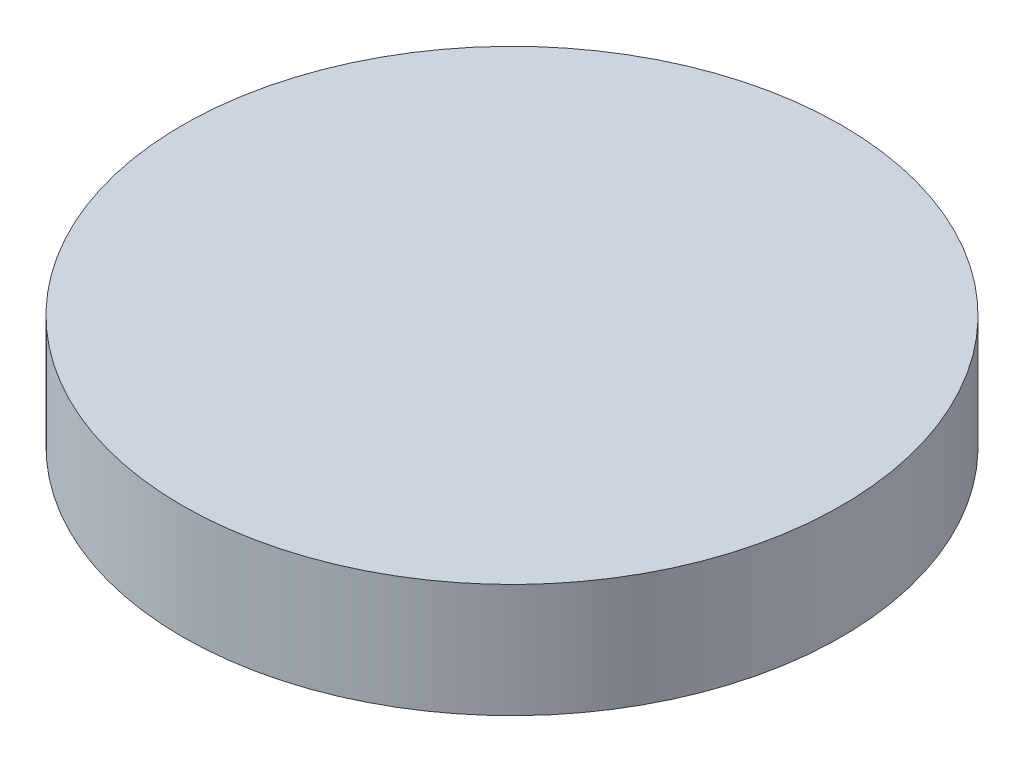
from build123d import *

# Parameters (mm, degrees)
SKETCH1_R           = 36.83
BOSS_EXTRUDE1_DEPTH = 12.7


with BuildPart() as part:
    # Sketch1 → Boss-Extrude1 (new body)
    with BuildSketch(Plane(origin=(0, 0, 0), x_dir=(1, 0, 0), z_dir=(0, 1, 0))):
        Circle(SKETCH1_R)
    extrude(amount=BOSS_EXTRUDE1_DEPTH)


solid = part.part
